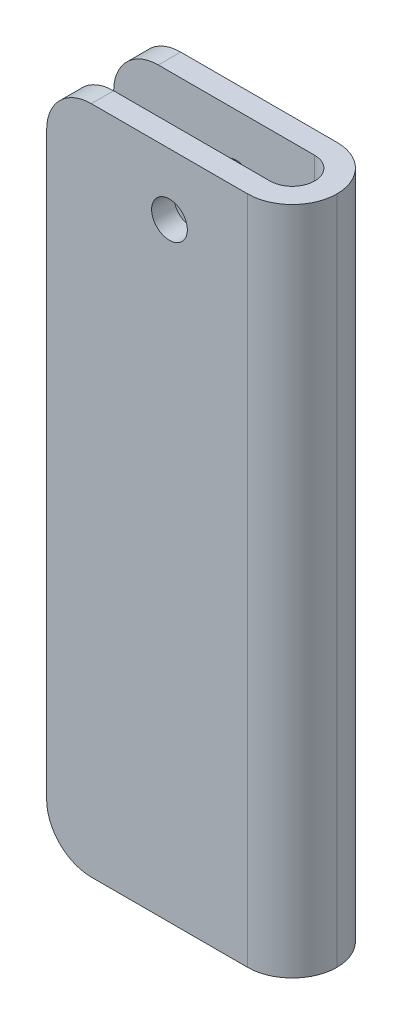
from build123d import *

# Parameters (mm, degrees)
ESQUISSE1_W             = 55
ESQUISSE1_H             = 150
BOSS_EXTRU_1_DEPTH      = 20
ESQUISSE2_W             = 50
ESQUISSE2_H             = 10
ENL_V_MAT_EXTRU_1_DEPTH = 162.012421881
ESQUISSE3_R             = 4
ENL_V_MAT_EXTRU_2_DEPTH = 20
CONG_1_R                = 5
CONG_2_R                = 10
CONG_3_R                = 10


with BuildPart() as part:
    # Esquisse1 → Boss.-Extru.1 (new body)
    with BuildSketch(Plane.XY):
        with Locations((-27.5, 75)):
            Rectangle(ESQUISSE1_W, ESQUISSE1_H)
    extrude(amount=BOSS_EXTRU_1_DEPTH)

    # Esquisse2 → Enlèv. mat.-Extru.1 (cut, through all)
    with BuildSketch(Plane(origin=(0, 150, 0), x_dir=(1, 0, 0), z_dir=(0, 1, 0))):
        with Locations((-30, -10)):
            Rectangle(ESQUISSE2_W, ESQUISSE2_H)
    extrude(amount=-ENL_V_MAT_EXTRU_1_DEPTH, mode=Mode.SUBTRACT)

    # Esquisse3 → Enlèv. mat.-Extru.2 (cut)
    with BuildSketch(Plane(origin=(0, 0, 0), x_dir=(-1, 0, 0), z_dir=(0, 0, -1))):
        with Locations((27.5, 136.25286599)):
            Circle(ESQUISSE3_R)
    extrude(amount=-ENL_V_MAT_EXTRU_2_DEPTH, mode=Mode.SUBTRACT)

    # Congé1
    cong_1_edges = [part.edges().sort_by_distance(p)[0] for p in [
        (-5, 75, 15),
        (-5, 75, 5),
    ]]
    fillet(cong_1_edges, radius=CONG_1_R - 0.0001)  # a hair under: the kernel refuses the full size

    # Congé2
    cong_2_edges = [part.edges().sort_by_distance(p)[0] for p in [
        (0, 75, 0),
        (0, 75, 20),
    ]]
    fillet(cong_2_edges, radius=CONG_2_R - 0.0001)  # a hair under: the kernel refuses the full size

    # Congé3
    cong_3_edges = [part.edges().sort_by_distance(p)[0] for p in [
        (-55, 0, 2.5),
        (-55, 150, 2.5),
        (-55, 0, 17.5),
        (-55, 150, 17.5),
    ]]
    fillet(cong_3_edges, radius=CONG_3_R)


solid = part.part
